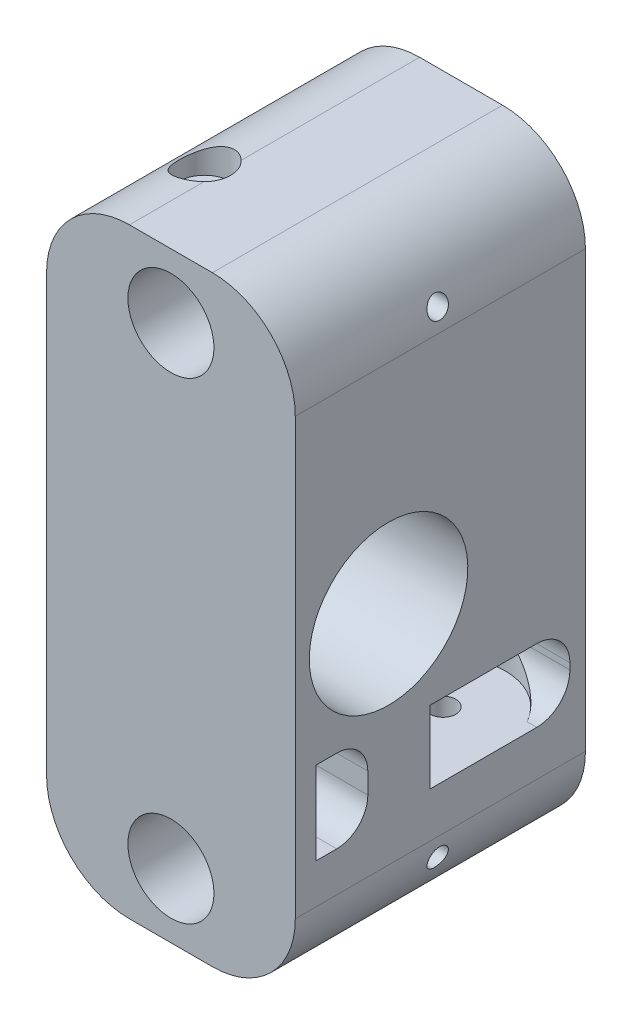
from build123d import *

# Parameters (mm, degrees)
SKETCH_1_W           = 24
SKETCH_1_H           = 58
EXTRUDE_1_DEPTH      = 19
SKETCH_2_R           = 7.65
CUT_EXTRUDE_1_DEPTH  = 43.166337285
CUT_EXTRUDE_2_DEPTH  = 3.5
SKETCH_4_W           = 5
SKETCH_4_H           = 8
CUT_EXTRUDE_3_DEPTH  = 43.166337285
CUT_EXTRUDE_4_DEPTH  = 3.5
SKETCH_6_R           = 4.15
CUT_EXTRUDE_5_DEPTH  = 50.284886121
SKETCH_7_W           = 39.774970528
SKETCH_7_H           = 16.116769404
CUT_EXTRUDE_6_DEPTH  = 63.20128616
SKETCH_8_R           = 1.25
CUT_EXTRUDE_7_DEPTH  = 22
SKETCH_9_R           = 1.25
CUT_EXTRUDE_8_DEPTH  = 22
FILLET_1_R           = 8
SKETCH_11_R          = 2.5
CUT_EXTRUDE_9_DEPTH  = 3
SKETCH_12_R          = 2.5
CUT_EXTRUDE_10_DEPTH = 3
SKETCH_13_R          = 1
CUT_EXTRUDE_11_DEPTH = 43.166337455
FILLET_2_R           = 3
EXTRUDE_2_REACH      = 46.708
SKETCH_14_W          = 10.25
SKETCH_14_H          = 9
FILLET_3_R           = 3.2
EXTRUDE_3_REACH      = 46.708
SKETCH_16_W          = 10.25
SKETCH_16_H          = 1.5
FILLET_4_R           = 3.2
CUT_EXTRUDE_12_REACH = 46.708
SKETCH_17_R          = 6


with BuildPart() as part:
    # 草图1 → 凸台-拉伸1 (new, symmetric)
    with BuildSketch(Plane.XY):
        Rectangle(SKETCH_1_W, SKETCH_1_H)
    extrude(amount=EXTRUDE_1_DEPTH, both=True)

    # 草图2 → 切除-拉伸1 (cut, through all)
    with BuildSketch(Plane(origin=(12, 0, 0), x_dir=(0, 0, -1), z_dir=(1, 0, 0))):
        with Locations(Location((0, 0, 0), (0, 0, 90))):
            Circle(SKETCH_2_R)
    extrude(amount=-CUT_EXTRUDE_1_DEPTH, mode=Mode.SUBTRACT)

    # 草图3 → 切除-拉伸2 (cut, symmetric)
    with BuildSketch(Plane(origin=(0, 13.15, 0), x_dir=(1, 0, 0), z_dir=(0, 1, 0))):
        with BuildLine():
            Line((-5.75, -7.5), (-12, -7.5))
            Line((-12, -7.5), (-12, 19))
            Line((-12, 19), (1.75, 19))
            Line((1.75, 19), (1.75, 0))
            ThreePointArc((1.75, 0), (-0.446699141, -5.303300859), (-5.75, -7.5))
        make_face()
    extrude(amount=CUT_EXTRUDE_2_DEPTH, both=True, mode=Mode.SUBTRACT)

    # 草图4 → 切除-拉伸3 (cut, through all)
    with BuildSketch(Plane.ZY.offset(12)):
        with Locations((4.5, -13.15)):
            Rectangle(SKETCH_4_W, SKETCH_4_H)
    extrude(amount=-CUT_EXTRUDE_3_DEPTH, mode=Mode.SUBTRACT)

    # 草图5 → 切除-拉伸4 (cut, symmetric)
    with BuildSketch(Plane(origin=(0, -13.15, 0), x_dir=(1, 0, 0), z_dir=(0, 1, 0))):
        with BuildLine():
            Line((5.75, 4), (12, 4))
            Line((12, 4), (12, 19))
            Line((12, 19), (-1.75, 19))
            Line((-1.75, 19), (-1.75, 11.5))
            ThreePointArc((-1.75, 11.5), (0.446699141, 6.196699141), (5.75, 4))
        make_face()
    extrude(amount=CUT_EXTRUDE_4_DEPTH, both=True, mode=Mode.SUBTRACT)

    # 草图6 → 切除-拉伸5 (cut, through all)
    with BuildSketch(Plane(origin=(0, 0, -19), x_dir=(-1, 0, 0), z_dir=(0, 0, -1))):
        with Locations((0, 22.8)):
            Circle(SKETCH_6_R)
        with Locations(Location((0, -22.8, 0), (0, 0, 180))):
            Circle(SKETCH_6_R)
    extrude(amount=-CUT_EXTRUDE_5_DEPTH, mode=Mode.SUBTRACT)

    # 草图7 → 切除-拉伸6 (cut, through all)
    with BuildSketch(Plane(origin=(0, 29, 0), x_dir=(1, 0, 0), z_dir=(0, 1, 0))):
        with Locations((2.463128909, -17.058384702)):
            Rectangle(SKETCH_7_W, SKETCH_7_H)
    extrude(amount=-CUT_EXTRUDE_6_DEPTH, mode=Mode.SUBTRACT)

    # 草图8 → 切除-拉伸7 (cut)
    with BuildSketch(Plane.XZ.offset(29)):
        with Locations(Location((5.75, -11.5, 0), (0, 0, 270))):
            Circle(SKETCH_8_R)
    extrude(amount=-CUT_EXTRUDE_7_DEPTH, mode=Mode.SUBTRACT)

    # 草图9 → 切除-拉伸8 (cut)
    with BuildSketch(Plane(origin=(0, 29, 0), x_dir=(1, 0, 0), z_dir=(0, 1, 0))):
        with Locations(Location((-5.75, 0, 0), (0, 0, 270))):
            Circle(SKETCH_9_R)
    extrude(amount=-CUT_EXTRUDE_8_DEPTH, mode=Mode.SUBTRACT)

    # 圆角1
    # the kernel refuses this fillet: 8 mm, written as the material it takes off along each edge
    with BuildSketch(Plane(origin=(12, -29, 29), x_dir=(0, 1, 0), z_dir=(0, 0, -1)), Plane(origin=(-12, -29, -39), x_dir=(0, 1, 0), z_dir=(0, 0, 1)), Plane(origin=(-12, 29, -39), x_dir=(1, 0, 0), z_dir=(0, 0, 1)), Plane(origin=(12, 29, 29), x_dir=(-1, 0, 0), z_dir=(0, 0, -1))) as fillet_1_piece_1:
        with BuildLine():
            CenterArc((FILLET_1_R, -FILLET_1_R), FILLET_1_R, 90, 90)
            Line((0, -FILLET_1_R), (0, 0))
            Line((0, 0), (FILLET_1_R, 0))
        make_face()
    extrude(amount=68, mode=Mode.SUBTRACT)

    # 草图11 → 切除-拉伸9 (cut)
    with BuildSketch(Plane.XZ.offset(29)):
        with Locations(Location((5.75, -11.5, 0), (0, 0, 270))):
            Circle(SKETCH_11_R)
    extrude(amount=-CUT_EXTRUDE_9_DEPTH, mode=Mode.SUBTRACT)

    # 草图12 → 切除-拉伸10 (cut)
    with BuildSketch(Plane(origin=(0, 29, 0), x_dir=(1, 0, 0), z_dir=(0, 1, 0))):
        with Locations(Location((-5.75, 0, 0), (0, 0, 270))):
            Circle(SKETCH_12_R)
    extrude(amount=-CUT_EXTRUDE_10_DEPTH, mode=Mode.SUBTRACT)

    # 草图13 → 切除-拉伸11 (cut, through all)
    with BuildSketch(Plane.ZY.offset(12)):
        with Locations(Location((-5, -23, 0), (0, 0, 270))):
            Circle(SKETCH_13_R)
        with Locations(Location((-5, 23, 0), (0, 0, 270))):
            Circle(SKETCH_13_R)
    extrude(amount=-CUT_EXTRUDE_11_DEPTH, mode=Mode.SUBTRACT)

    # 圆角2
    fillet_2_edges = [part.edges().sort_by_distance(p)[0] for p in [
        (0, -17.15, 2),
        (0, -9.15, 2),
    ]]
    fillet(fillet_2_edges, radius=FILLET_2_R)

    # 草图14 → 凸台-拉伸2 (add, up to next)
    with BuildSketch(Plane(origin=(0, 9.65, 0), x_dir=(1, 0, 0), z_dir=(0, 1, 0)), mode=Mode.PRIVATE) as extrude_2_sk1:
        with Locations((-6.875, 14.5)):
            Rectangle(SKETCH_14_W, SKETCH_14_H)
    extrude_2_tool1 = extrude(extrude_2_sk1.sketch, amount=EXTRUDE_2_REACH, mode=Mode.PRIVATE) - part.part
    add(extrude_2_tool1.solids().sort_by_distance((-6.875, 9.65, -14.5))[0])

    # 圆角3
    fillet_3_edges = [part.edges().sort_by_distance(p)[0] for p in [
        (-6.875, 16.65, -10),
        (-6.875, 9.65, -10),
    ]]
    fillet(fillet_3_edges, radius=FILLET_3_R)

    # 草图16 → 凸台-拉伸3 (add, up to next)
    with BuildSketch(Plane.XZ.offset(9.65), mode=Mode.PRIVATE) as extrude_3_sk1:
        with Locations((6.875, -18.25)):
            Rectangle(SKETCH_16_W, SKETCH_16_H)
    extrude_3_tool1 = extrude(extrude_3_sk1.sketch, amount=EXTRUDE_3_REACH, mode=Mode.PRIVATE) - part.part
    add(extrude_3_tool1.solids().sort_by_distance((6.875, -9.65, -18.25))[0])

    # 圆角4
    fillet_4_edges = [part.edges().sort_by_distance(p)[0] for p in [
        (6.875, -16.65, -17.5),
        (6.875, -9.65, -17.5),
    ]]
    fillet(fillet_4_edges, radius=FILLET_4_R)

    # 切除-拉伸12: up to this face of the body (flat: up to its plane)
    cut_extrude_12_end = Plane(part.part.faces().sort_by_distance((4.950604568, -16.65, -10.239935039))[0])
    # 草图17 → 切除-拉伸12 (cut, up to the picked face)
    with BuildSketch(Plane.XZ.offset(9.65), mode=Mode.PRIVATE) as cut_extrude_12_sk1:
        with Locations((5.75, -11.5)):
            Circle(SKETCH_17_R)
    cut_extrude_12_tool1 = split(extrude(cut_extrude_12_sk1.sketch, amount=CUT_EXTRUDE_12_REACH, mode=Mode.PRIVATE), bisect_by=cut_extrude_12_end, keep=Keep.BOTH, mode=Mode.PRIVATE)
    add(cut_extrude_12_tool1.solids().sort_by(Axis((5.75, -9.65, -11.5), (0, -1, 0)))[0], mode=Mode.SUBTRACT)


solid = part.part
